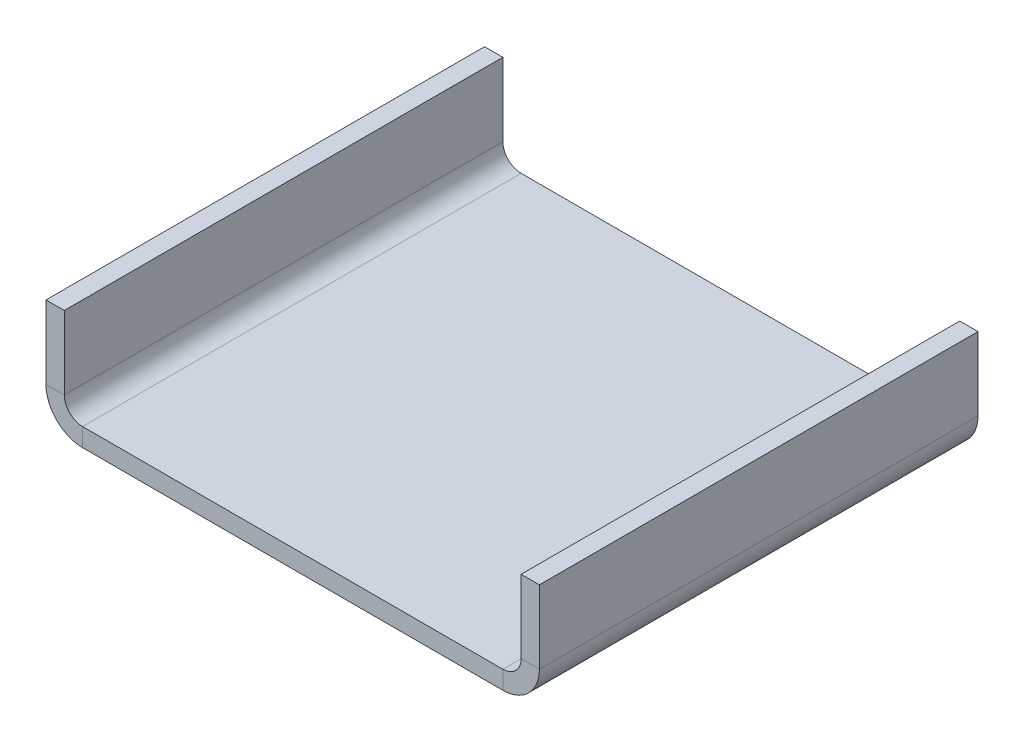
from build123d import *

# Parameters (mm, degrees)
BASE_FLANGE1_DEPTH = 76.2


# Sheet-metal steps are written as plain solids
with BuildPart() as part:
    # Sketch1 → Base-Flange1 (new body)
    with BuildSketch(Plane.XY):
        with BuildLine():
            Line((85.725, 19.05), (85.725, 6.35))
            ThreePointArc((85.725, 6.35), (83.865128061, 1.859871939), (79.375, 0))
            Line((79.375, 0), (6.35, 0))
            ThreePointArc((6.35, 0), (1.859871939, 1.859871939), (0, 6.35))
            Line((0, 6.35), (0, 19.05))
            Line((0, 19.05), (3.175, 19.05))
            Line((3.175, 19.05), (3.175, 6.35))
            ThreePointArc((3.175, 6.35), (4.10493597, 4.10493597), (6.35, 3.175))
            Line((6.35, 3.175), (79.375, 3.175))
            ThreePointArc((79.375, 3.175), (81.62006403, 4.10493597), (82.55, 6.35))
            Line((82.55, 6.35), (82.55, 19.05))
            Line((82.55, 19.05), (85.725, 19.05))
        make_face()
    extrude(amount=BASE_FLANGE1_DEPTH)


solid = part.part
